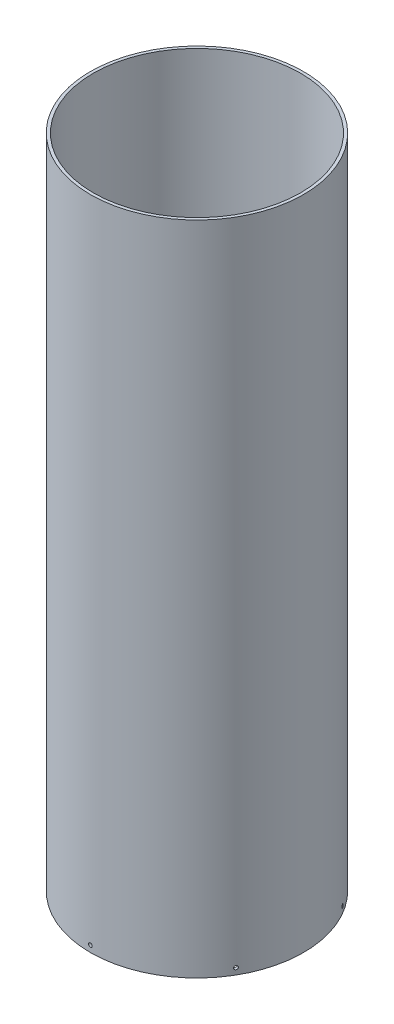
from build123d import *

# Parameters (mm, degrees)
SKETCH1_R           = 78.359
SKETCH1_R_2         = 76.2
BOSS_EXTRUDE1_DEPTH = 482.6
SKETCH2_R           = 1.35255
CUT_EXTRUDE1_DEPTH  = 496.159596254
CIRPATTERN1_COUNT   = 6


with BuildPart() as part:
    # Sketch1 → Boss-Extrude1 (new body)
    with BuildSketch(Plane(origin=(0, 0, 0), x_dir=(1, 0, 0), z_dir=(0, 1, 0))):
        Circle(SKETCH1_R)
        Circle(SKETCH1_R_2, mode=Mode.SUBTRACT)
    extrude(amount=BOSS_EXTRUDE1_DEPTH)

    # Sketch2 → Cut-Extrude1 (cut, through all)
    with BuildSketch(Plane.XY):
        with Locations((0, 4.7625)):
            Circle(SKETCH2_R)
    cut_extrude1 = extrude(amount=-CUT_EXTRUDE1_DEPTH, mode=Mode.SUBTRACT)

    # CirPattern1: Cut-Extrude1 ×6 about axis
    cirpattern1_axis = Axis((0, 482.6, 0), (0, -1, 0))
    for i in range(1, CIRPATTERN1_COUNT):
        add(cut_extrude1.rotate(cirpattern1_axis, i * 360 / CIRPATTERN1_COUNT), mode=Mode.SUBTRACT)


solid = part.part
